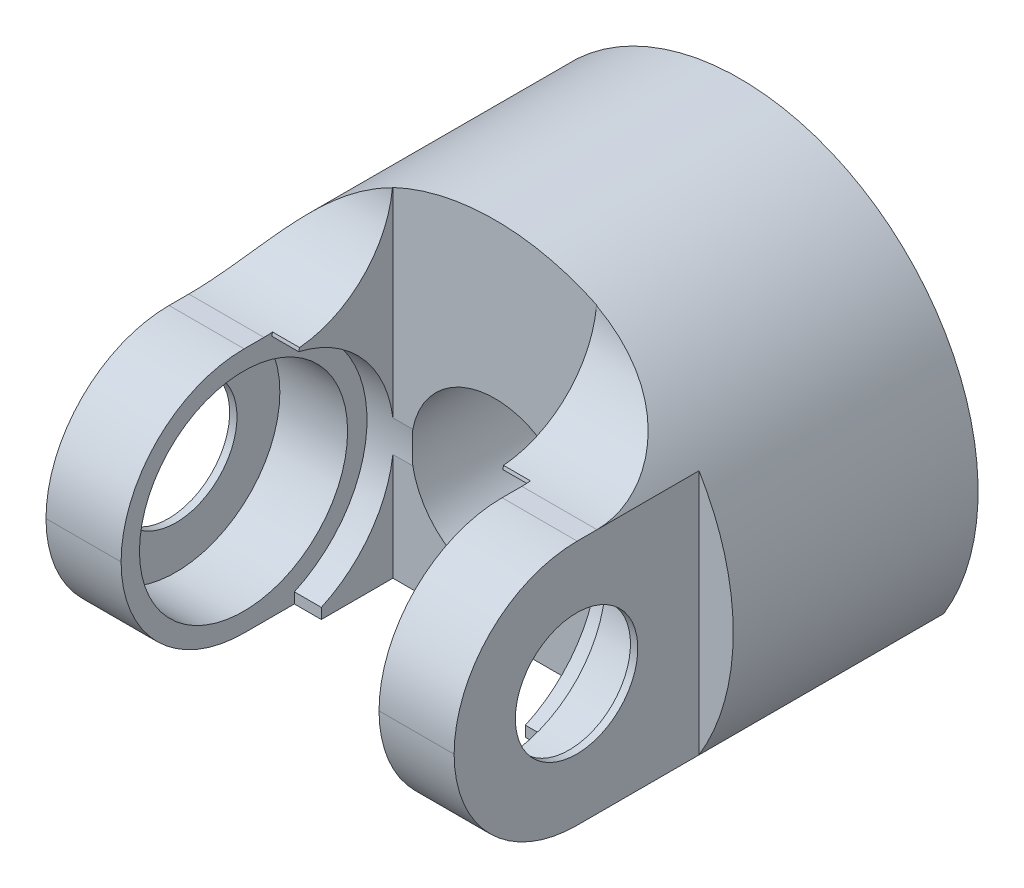
from build123d import *

# Parameters (mm, degrees)
BOSS_EXTRUDE1_DEPTH      = 6
BOSS_EXTRUDE1_2_DEPTH    = 6
SKETCH2_R                = 5.838683498871983
BOSS_EXTRUDE2_DEPTH      = 6
CUT_EXTRUDE1_DEPTH       = 14.695520617658893
CUT_EXTRUDE1_DEPTH_BACK  = 14.695520617658893
SKETCH4_R                = 1.5000000000000004
SKETCH5_W                = 10
SKETCH5_H                = 5.878381978264198
CUT_EXTRUDE2_DEPTH       = 6
CUT_EXTRUDE19_DEPTH      = 11.206882481933452
CUT_EXTRUDE19_DEPTH_BACK = 11.206882481933452
SKETCH31_R               = 1.1
SKETCH33_W               = 5.1
SKETCH33_H               = 1.7000000000000002
CUT_EXTRUDE20_DEPTH      = 6.03
BOSS_EXTRUDE3_DEPTH      = 0.7
BOSS_EXTRUDE4_DEPTH      = 1.7
CUT_EXTRUDE21_START      = 0.7
SKETCH36_R               = 3.05
CUT_EXTRUDE21_DEPTH      = 0.7
SKETCH37_R               = 2.05
CUT_EXTRUDE22_DEPTH      = 6.03
FILLET1_R                = 3.015
FILLET2_R                = 2.5
CUT_EXTRUDE23_DEPTH      = 4.82
CUT_EXTRUDE23_DEPTH_BACK = 4.82
SKETCH39_R               = 2.5500000000000003
CUT_EXTRUDE24_DEPTH      = 3.16
CUT_EXTRUDE24_DEPTH_BACK = 3.16
SKETCH40_R               = 3.025
CHAMFER1_START           = -3.16
CHAMFER1_DEPTH           = 6.32


with BuildPart() as part:
    # Sketch1 → Boss-Extrude1 (new body)
    with BuildSketch(Plane.XY):
        Polygon((-2.4999999999999982, -3.015), (-2.499999999999999, 3.015), (-4.999999999999999, 3.015), (-4.999999999999999, -3.015), align=None)
    extrude(amount=BOSS_EXTRUDE1_DEPTH)



with BuildPart() as body_2:
    # Sketch1 → Boss-Extrude1 2 (new body)
    with BuildSketch(Plane.XY):
        Polygon((5.000000000000001, 3.015), (2.500000000000001, 3.015), (2.5000000000000018, -3.015), (5.000000000000001, -3.015), align=None)
    extrude(amount=BOSS_EXTRUDE1_2_DEPTH)


with BuildPart() as part_1:
    add(part.part)

    add(body_2.part)  # Boss-Extrude2 merges body 2
    # Sketch2 → Boss-Extrude2 (add)
    with BuildSketch(Plane(origin=(0, 0, 0), x_dir=(-1, 0, 0), z_dir=(0, 0, -1))):
        with Locations(Location((0, 0, 0), (0, 0, 148.91002298))):
            Circle(SKETCH2_R)
    extrude(amount=BOSS_EXTRUDE2_DEPTH)

    # Sketch4 → Cut-Extrude1 (cut, two sides: drawn at the far end of the back side and taken through both)
    with BuildSketch(Plane.ZY.offset(4.999999999999999).offset(-CUT_EXTRUDE1_DEPTH_BACK)):
        with Locations((3, 0)):
            Circle(SKETCH4_R)
    extrude(amount=CUT_EXTRUDE1_DEPTH + CUT_EXTRUDE1_DEPTH_BACK, mode=Mode.SUBTRACT)

    # Sketch5 → Cut-Extrude2 (cut)
    with BuildSketch(Plane.XY):
        with Locations((4.4e-16, -5.954190989132099)):
            Rectangle(SKETCH5_W, SKETCH5_H)
    extrude(amount=-CUT_EXTRUDE2_DEPTH, mode=Mode.SUBTRACT)

    # Sketch31 → Cut-Extrude19 (cut, two sides: drawn at the far end of the back side and taken through both)
    with BuildSketch(Plane.XY.offset(-CUT_EXTRUDE19_DEPTH_BACK)):
        Circle(SKETCH31_R)
    extrude(amount=CUT_EXTRUDE19_DEPTH + CUT_EXTRUDE19_DEPTH_BACK, mode=Mode.SUBTRACT)

    # Sketch33 → Cut-Extrude20 (cut)
    with BuildSketch(Plane(origin=(0, -3.015, 0), x_dir=(-1, 0, 0), z_dir=(0, -1, 0))):
        with Locations((-8.9e-16, 5.15)):
            Rectangle(SKETCH33_W, SKETCH33_H)
        Polygon((3.0500000000000056, 4.299999999999999), (2.549999999999999, 4.299999999999999), (-2.5500000000000007, 4.3), (-3.049999999999994, 4.299999999999999), (-3.049999999999994, 3.599999999999999), (3.0500000000000056, 3.6), align=None)
    extrude(amount=-CUT_EXTRUDE20_DEPTH, mode=Mode.SUBTRACT)

    # Sketch34 → Boss-Extrude3 (add)
    with BuildSketch(Plane(origin=(5.1e-16, 0, -3.5999999999999996), x_dir=(-1, 0, -1.4e-16), z_dir=(1.4e-16, 0, -1))):
        with BuildLine():
            ThreePointArc((0.4607331114646439, 3.0150000000000117), (2.313842690198183, 1.9871165051441753), (3.049999999999994, 0))
            Line((3.049999999999994, 0), (3.050000000000006, 3.015))
            Line((3.050000000000006, 3.015), (0.46073311146464313, 3.015))
        make_face()
        with BuildLine():
            Line((-3.0499999999999936, 3.015), (-3.049999999999994, 0))
            ThreePointArc((-3.049999999999994, 3.7e-16), (-2.313842690198182, 1.987116505144176), (-0.46073311146464346, 3.0150000000000117))
            Line((-0.4607331114646427, 3.015), (-3.0499999999999936, 3.015))
        make_face()
    extrude(amount=BOSS_EXTRUDE3_DEPTH)

    # Sketch35 → Boss-Extrude4 (add)
    with BuildSketch(Plane(origin=(0, 0, -6), x_dir=(-1, 0, 0), z_dir=(0, 0, -1))):
        with BuildLine():
            ThreePointArc((-2.550000000000001, -8.2e-16), (-4.1e-16, 2.550000000000001), (2.550000000000001, 0))
            Line((2.5500000000000007, 0), (2.549999999999999, 3.015))
            Line((2.549999999999999, 3.015), (-2.5500000000000007, 3.015))
            Line((-2.5500000000000007, 3.015), (-2.5500000000000007, 0))
        make_face()
    extrude(amount=-BOSS_EXTRUDE4_DEPTH)

    # Sketch36 → Cut-Extrude21 (cut)
    with BuildSketch(Plane.XY.offset(-4.299999999999999).offset(CUT_EXTRUDE21_START)):
        Circle(SKETCH36_R)
    extrude(amount=-CUT_EXTRUDE21_DEPTH, mode=Mode.SUBTRACT)

    # Sketch37 → Cut-Extrude22 (cut)
    with BuildSketch(Plane(origin=(5.1e-16, 0, -3.5999999999999996), x_dir=(-1, 0, -1.4e-16), z_dir=(1.4e-16, 0, -1))):
        Circle(SKETCH37_R)
    extrude(amount=-CUT_EXTRUDE22_DEPTH, mode=Mode.SUBTRACT)

    # Fillet1
    fillet1_edges = [part_1.edges().sort_by_distance(p)[0] for p in [
        (-3.749999999999999, 3.015, 6),
        (-3.7499999999999987, -3.015, 6),
        (3.7500000000000013, -3.015, 6),
        (3.750000000000001, 3.015, 6),
    ]]
    fillet(fillet1_edges, radius=FILLET1_R - 0.0001)  # a hair under: the kernel refuses the full size

    # Fillet2
    # the kernel refuses this fillet: 2.5 mm, written as the material it adds along each edge
    with BuildSketch(Plane(origin=(5.000000000000001, 3.015, 0), x_dir=(0, 1, 0), z_dir=(-1, 0, 0))) as fillet2_piece_1_section:
        with BuildLine():
            CenterArc((FILLET2_R, -FILLET2_R), FILLET2_R, 90, 90)
            Line((-4.4e-16, -FILLET2_R), (0, 0))
            Line((0, 0), (FILLET2_R, 0))
        make_face()
    fillet2_piece_1 = extrude(amount=2.5, mode=Mode.PRIVATE)
    fillet2_piece_1 = fillet2_piece_1 & Plane(origin=(0, 0, 0), x_dir=(0.8563574307404789, 0.5163835307361826, 0), z_dir=(0, 0, 1)) * Cylinder(5.838683498871983, 15, mode=Mode.PRIVATE)
    add(fillet2_piece_1)
    with BuildSketch(Plane(origin=(5.000000000000001, 3.015, 0), x_dir=(0, 1, 0), z_dir=(-1, 0, 0))) as fillet2_piece_2_section:
        with BuildLine():
            CenterArc((FILLET2_R, -FILLET2_R), FILLET2_R, 90, 90)
            Line((-4.4e-16, -FILLET2_R), (0, 0))
            Line((0, 0), (FILLET2_R, 0))
        make_face()
    fillet2_piece_2 = extrude(amount=8.749999999999998, mode=Mode.PRIVATE)
    fillet2_piece_2 = fillet2_piece_2 & Plane(origin=(0, 0, 0), x_dir=(0.8563574307404789, 0.5163835307361826, 0), z_dir=(0, 0, 1)) * Cylinder(5.838683498871983, 28, mode=Mode.PRIVATE)
    fillet2_piece_2 = split(fillet2_piece_2, bisect_by=Plane(origin=(-2.499999999999999, 3.0149999999999992, 0), z_dir=(-1, -1.5e-16, 0)), keep=Keep.TOP, mode=Mode.PRIVATE)
    add(fillet2_piece_2)
    with BuildSketch(Plane(origin=(3.75, 3.015, 0), x_dir=(0, 1, 0), z_dir=(-1, 0, 0))) as fillet2_piece_3_section:
        with BuildLine():
            CenterArc((FILLET2_R, -FILLET2_R), FILLET2_R, 90, 90)
            Line((-4.4e-16, -FILLET2_R), (0, 0))
            Line((0, 0), (FILLET2_R, 0))
        make_face()
    fillet2_piece_3 = extrude(amount=8.75, mode=Mode.PRIVATE)
    fillet2_piece_3 = fillet2_piece_3 & Plane(origin=(0, 0, 0), x_dir=(0.8563574307404789, 0.5163835307361826, 0), z_dir=(0, 0, 1)) * Cylinder(5.838683498871983, 28, mode=Mode.PRIVATE)
    fillet2_piece_3 = split(fillet2_piece_3, bisect_by=Plane(origin=(2.500000000000001, 3.015, 0), z_dir=(1, 1.5e-16, 0)), keep=Keep.TOP, mode=Mode.PRIVATE)
    add(fillet2_piece_3)
    with BuildSketch(Plane(origin=(-2.499999999999999, 3.015, 0), x_dir=(0, 1, 0), z_dir=(-1, 0, 0))) as fillet2_piece_4_section:
        with BuildLine():
            CenterArc((FILLET2_R, -FILLET2_R), FILLET2_R, 90, 90)
            Line((-4.4e-16, -FILLET2_R), (0, 0))
            Line((0, 0), (FILLET2_R, 0))
        make_face()
    fillet2_piece_4 = extrude(amount=2.5, mode=Mode.PRIVATE)
    fillet2_piece_4 = fillet2_piece_4 & Plane(origin=(0, 0, 0), x_dir=(0.8563574307404789, 0.5163835307361826, 0), z_dir=(0, 0, 1)) * Cylinder(5.838683498871983, 15, mode=Mode.PRIVATE)
    add(fillet2_piece_4)

    # Sketch39 → Cut-Extrude23 (cut, two sides: drawn at the far end of the back side and taken through both)
    with BuildSketch(Plane(origin=(0, 0, 0), x_dir=(0, 0, -1), z_dir=(1, 0, 0)).offset(-CUT_EXTRUDE23_DEPTH_BACK)):
        with Locations((-3, 0)):
            Circle(SKETCH39_R)
    extrude(amount=CUT_EXTRUDE23_DEPTH + CUT_EXTRUDE23_DEPTH_BACK, mode=Mode.SUBTRACT)

    # Sketch40 → Cut-Extrude24 (cut, two sides: drawn at the far end of the back side and taken through both)
    with BuildSketch(Plane(origin=(0, 0, 0), x_dir=(0, 0, -1), z_dir=(1, 0, 0)).offset(-CUT_EXTRUDE24_DEPTH_BACK)):
        with Locations((-3, 0)):
            Circle(SKETCH40_R)
    extrude(amount=CUT_EXTRUDE24_DEPTH + CUT_EXTRUDE24_DEPTH_BACK, mode=Mode.SUBTRACT)

    # Chamfer1: read off the stored shape, not the designer's step
    # Chamfer1 outline → Chamfer1 (cut)
    with BuildSketch(Plane.YZ.offset(CHAMFER1_START)):
        with BuildLine():
            ThreePointArc((3.015, 2.754235885), (2.988173778, 2.529423252), (2.944608274, 2.307246717))
            Line((2.944608274, 2.307246717), (3.023955784, 2.288579294))
            ThreePointArc((3.023955784, 2.288579294), (3.01723995, 2.394194848), (3.015, 2.5))
            Line((3.015, 2.5), (3.015, 2.754235885))
        make_face()
        with BuildLine():
            Line((-3.015, 1.754235885), (-2.756573375, 1.754235885))
            ThreePointArc((-2.756573375, 1.754235885), (-2.928782137, 2.243124716), (-3.015, 2.754235885))
            Line((-3.015, 2.754235885), (-3.015, 1.754235885))
        make_face()
    extrude(amount=CHAMFER1_DEPTH, mode=Mode.SUBTRACT)


solid = part_1.part
